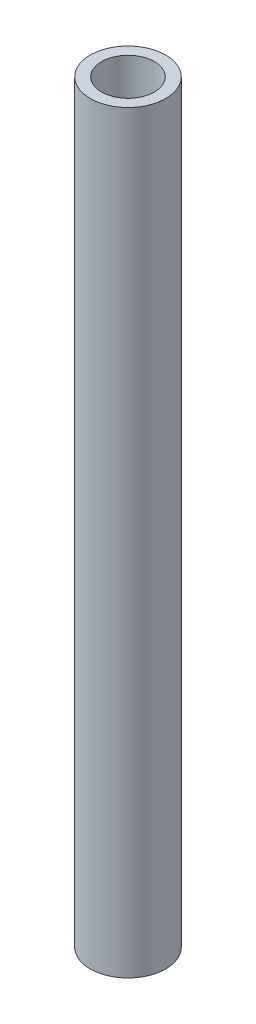
from build123d import *

# Parameters (mm, degrees)
SKETCH1_R           = 5
SKETCH1_R_2         = 3.5
BOSS_EXTRUDE1_DEPTH = 50


with BuildPart() as part:
    # Sketch1 → Boss-Extrude1 (new, symmetric)
    with BuildSketch(Plane(origin=(0, 0, 0), x_dir=(1, 0, 0), z_dir=(0, 1, 0))):
        Circle(SKETCH1_R)
        Circle(SKETCH1_R_2, mode=Mode.SUBTRACT)
    extrude(amount=BOSS_EXTRUDE1_DEPTH, both=True)


solid = part.part
